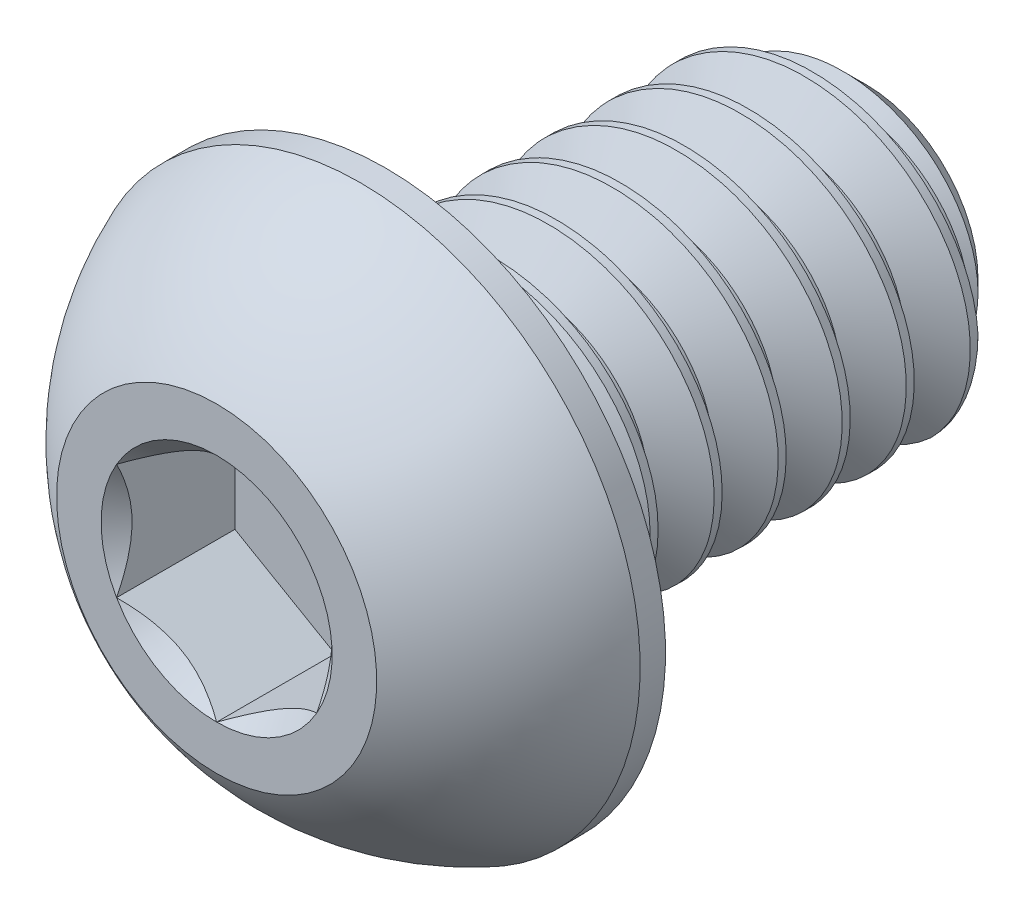
from build123d import *

# Parameters (mm, degrees)
CUT_EXTRUDE2_DEPTH = 2.34696
CHAMFER1_SIZE      = 0.9525
CUT_SWEEP1_PITCH   = 1.27
CUT_SWEEP1_TO      = 9.525


with BuildPart() as part:
    # Sketch12 → Revolve3 (revolve)
    with BuildSketch(Plane(origin=(0, 0, 0), x_dir=(0, 0, -1), z_dir=(1, 0, 0)), mode=Mode.PRIVATE) as revolve3_sk:
        with BuildLine():
            Line((-8.1153, 0), (-8.1153, 3.175))
            ThreePointArc((-8.1153, 3.175), (-6.879378925, 4.58927271), (-5.26542, 5.5499))
            Line((-5.26542, 5.5499), (-4.7625, 5.5499))
            Line((-4.7625, 5.5499), (-4.7625, 3.175))
            Line((-4.7625, 3.175), (4.7625, 3.175))
            Line((4.7625, 3.175), (4.7625, 0))
            Line((4.7625, 0), (-8.1153, 0))
        make_face()
    revolve(revolve3_sk.sketch.rotate(Axis((0, 0, 8.1153), (0, 0, -1)), 180), axis=Axis((0, 0, 8.1153), (0, 0, -1)))

    # Sketch5 → Cut-Extrude2 (cut)
    with BuildSketch(Plane.XY.offset(8.1153)):
        Polygon((1.984375, -1.14567944), (1.984375, 1.14567944), (0, 2.291358881), (-1.984375, 1.14567944), (-1.984375, -1.14567944), (0, -2.291358881), align=None)
    extrude(amount=-CUT_EXTRUDE2_DEPTH, mode=Mode.SUBTRACT)

    # Cut-Extrude3 cone 1 section (through the dimple's axis) → Cut-Extrude3 (revolve, cut)
    with BuildSketch(Plane(origin=(0, 0, 8.1153), x_dir=(0, -1, 0), z_dir=(1, 0, 0))):
        Polygon((0, 0), (2.291358881, 0), (0, 2.291358881), align=None)
    revolve(axis=Axis((0, 0, 8.1153), (0, 0, -1)), mode=Mode.SUBTRACT)

    # Chamfer1
    chamfer1_edges = [part.edges().sort_by_distance(p)[0] for p in [
        (0, 3.175, -4.7625),
    ]]
    chamfer(chamfer1_edges, length=CHAMFER1_SIZE)


with BuildPart() as body_2:
    # Split1: read off the stored shape, not the designer's step
    # Split1: the piece on the far side of the plane
    add(part.part)
    split(bisect_by=Plane.XY.offset(4.7625), keep=Keep.BOTTOM)

    # Cut-Sweep1: arcs per turn and ends read off the stored shape
    # Cut-Sweep1: the profile of Sketch14 screwed along a right-hand helix through 8.5 turns, 8 arcs to a turn; built about Z, then put on its axis
    cut_sweep1_z = Axis((0, 0, 0), (0, 0, 1))
    cut_sweep1_corners = [(2.350110803, 0, -0.47625), (2.350110803, 0, -0.635), (3.243740766, 0, -1.1509375), (3.243740766, 0, 0.0396875)]
    with BuildLine(mode=Mode.PRIVATE) as cut_sweep1_profile:
        Line(cut_sweep1_corners[0], cut_sweep1_corners[1])
        Line(cut_sweep1_corners[1], cut_sweep1_corners[2])
        Line(cut_sweep1_corners[2], cut_sweep1_corners[3])
        Line(cut_sweep1_corners[3], cut_sweep1_corners[0])
    cut_sweep1_cap = Face(cut_sweep1_profile.wire())
    cut_sweep1_turn_angles = [0, 22.5, 45, 67.5, 90, 112.5, 135, 157.5, 180, 202.5, 225, 247.5, 270, 292.5, 315, 337.5, 360]
    cut_sweep1_turn_weights = [1, 0.9238795325112867, 1, 0.9238795325112867, 1, 0.9238795325112867, 1, 0.9238795325112867, 1, 0.9238795325112867, 1, 0.9238795325112867, 1, 0.9238795325112867, 1, 0.9238795325112867, 1]
    cut_sweep1_turn_rails = [Edge.make_bspline([Vector(p[0], p[1], 0).rotate(cut_sweep1_z, cut_sweep1_turn_angles[k]) / cut_sweep1_turn_weights[k] + Vector(0, 0, p[2] + CUT_SWEEP1_PITCH * cut_sweep1_turn_angles[k] / 360) for k in range(17)], [0, 0, 0, 1, 1, 2, 2, 3, 3, 4, 4, 5, 5, 6, 6, 7, 7, 8, 8, 8], 2, cut_sweep1_turn_weights) for p in cut_sweep1_corners]
    cut_sweep1_turn_sides = [Face.make_surface_from_curves(cut_sweep1_turn_rails[p[0]], cut_sweep1_turn_rails[p[1]]) for p in [(0, 1), (1, 2), (2, 3), (3, 0)]]
    cut_sweep1_last_angles = [2880, 2902.5, 2925, 2947.5, 2970, 2992.5, 3015, 3037.5, 3060]
    cut_sweep1_last_weights = [1, 0.9238795325112867, 1, 0.9238795325112867, 1, 0.9238795325112867, 1, 0.9238795325112792, 1]
    cut_sweep1_last_rails = [Edge.make_bspline([Vector(p[0], p[1], 0).rotate(cut_sweep1_z, cut_sweep1_last_angles[k]) / cut_sweep1_last_weights[k] + Vector(0, 0, p[2] + CUT_SWEEP1_PITCH * cut_sweep1_last_angles[k] / 360) for k in range(9)], [0, 0, 0, 1, 1, 2, 2, 3, 3, 4, 4, 4], 2, cut_sweep1_last_weights) for p in cut_sweep1_corners]
    cut_sweep1_last_sides = [Face.make_surface_from_curves(cut_sweep1_last_rails[p[0]], cut_sweep1_last_rails[p[1]]) for p in [(0, 1), (1, 2), (2, 3), (3, 0)]]
    cut_sweep1 = Plane(origin=(0, 0, -4.7625), x_dir=(0, 1, 0), z_dir=(0, 0, 1)) * split(Solid(Shell([*[p.moved(Location((0, 0, CUT_SWEEP1_PITCH * i))) for i in range(8) for p in cut_sweep1_turn_sides], *cut_sweep1_last_sides, cut_sweep1_cap, cut_sweep1_cap.rotate(cut_sweep1_z, 3060).moved(Location((0, 0, CUT_SWEEP1_PITCH * 3060 / 360)))])), bisect_by=Plane.XY.offset(CUT_SWEEP1_TO), keep=Keep.BOTTOM, mode=Mode.PRIVATE)
    add(cut_sweep1, mode=Mode.SUBTRACT)


with BuildPart() as part_1:
    add(part.part)

    # Split1
    split(bisect_by=Plane.XY.offset(4.7625), keep=Keep.TOP)

    add(body_2.part)  # Boss-Extrude4 merges body 2
    # Boss-Extrude4: read off the stored shape, not the designer's step
    # Boss-Extrude4 outline → Boss-Extrude4 (revolve)
    with BuildSketch(Plane.XZ):
        Polygon((2.350109328, 4.7625), (2.350109328, 2.496131506), (3.175, 4.7625), align=None)
    revolve(axis=Axis((0, 0, 0), (0, 0, 1)))


solid = part_1.part
